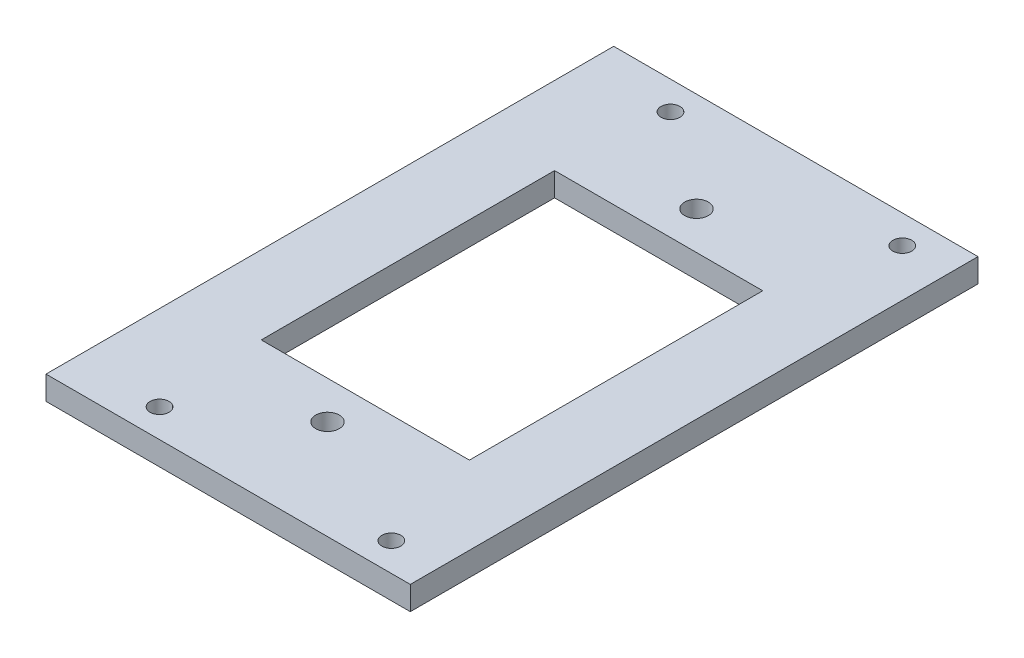
from build123d import *

# Parameters (mm, degrees)
SKETCH_1_W       = 77
SKETCH_1_H       = 120
SKETCH_1_R       = 2.5
SKETCH_1_W_2     = 44
SKETCH_1_H_2     = 62
EXTRUDE_1_DEPTH  = 5
MM_CLEARANCE_0_D = 4


with BuildPart() as part:
    # 草图1 → 凸台-拉伸1 (new body)
    with BuildSketch(Plane(origin=(0, 0, 0), x_dir=(1, 0, 0), z_dir=(0, 1, 0))):
        Rectangle(SKETCH_1_W, SKETCH_1_H)
        with Locations((0, 39)):
            Circle(SKETCH_1_R, mode=Mode.SUBTRACT)
        with Locations((0, -39)):
            Circle(SKETCH_1_R, mode=Mode.SUBTRACT)
        Rectangle(SKETCH_1_W_2, SKETCH_1_H_2, mode=Mode.SUBTRACT)
    extrude(amount=EXTRUDE_1_DEPTH)

    # 大小mm Clearance 暗销孔0 (through all)
    with Locations(Plane(origin=(0, 0, 0), x_dir=(-1, 0, 0), z_dir=(0, -1, 0))):
        with Locations((-28.5, 54), (20.5, 54)):
            mm_clearance_0 = Hole(MM_CLEARANCE_0_D / 2)

    # 镜向1: 大小mm Clearance 暗销孔0 across plane
    add(mm_clearance_0.mirror(Plane.XY), mode=Mode.SUBTRACT)


solid = part.part
